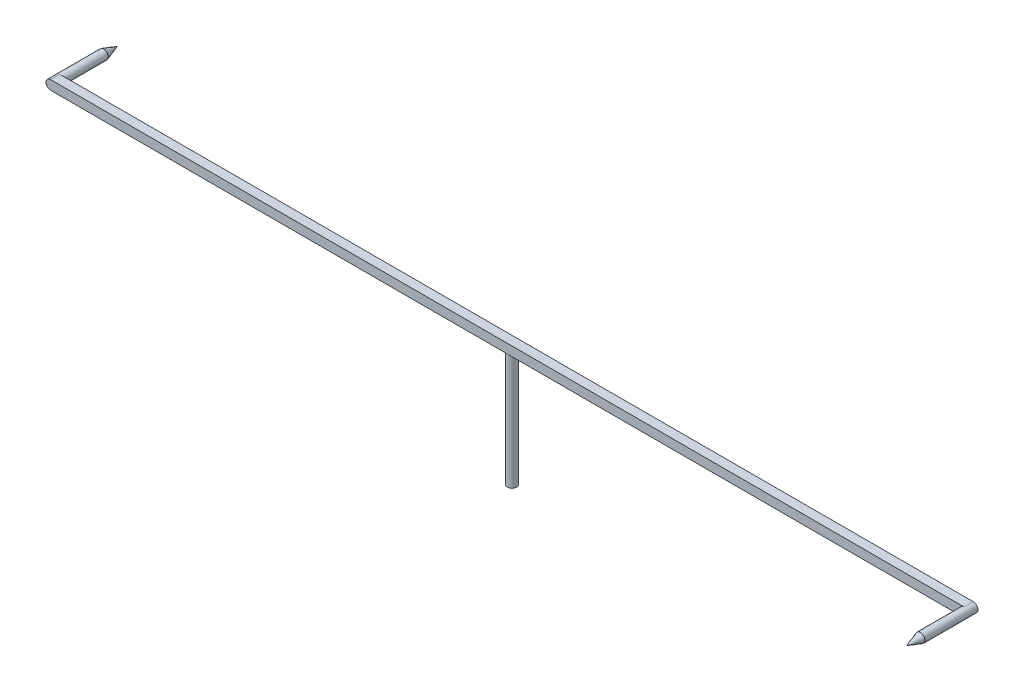
from build123d import *

# Parameters (mm, degrees)
SKETCH_1_R      = 0.4
EXTRUDE_1_DEPTH = 10
SKETCH_2_W      = 80
SKETCH_2_H      = 0.8
EXTRUDE_2_DEPTH = 0.8
FILLET_1_R      = 0.4
SKETCH_3_R      = 0.4
EXTRUDE_3_DEPTH = 3.8
SKETCH_4_R      = 0.4
EXTRUDE_4_DEPTH = 3.8


with BuildPart() as part:
    # 草图1 → 凸台-拉伸1 (new body)
    with BuildSketch(Plane(origin=(0, 0, 0), x_dir=(1, 0, 0), z_dir=(0, 1, 0))):
        with Locations(Location((0, 0, 0), (0, 0, 270))):
            Circle(SKETCH_1_R)
    extrude(amount=EXTRUDE_1_DEPTH)

    # 草图2 → 凸台-拉伸2 (add)
    with BuildSketch(Plane(origin=(0, 10, 0), x_dir=(1, 0, 0), z_dir=(0, 1, 0))):
        Rectangle(SKETCH_2_W, SKETCH_2_H)
    extrude(amount=EXTRUDE_2_DEPTH)

    # 圆角1
    fillet_1_edges = [part.edges().sort_by_distance(p)[0] for p in [
        (40, 10, 0),
        (40, 10.8, 0),
        (-40, 10, 0),
        (-40, 10.8, 0),
    ]]
    fillet(fillet_1_edges, radius=FILLET_1_R - 0.0001)  # a hair under: the kernel refuses the full size

    # 草图3 → 凸台-拉伸3 (add)
    with BuildSketch(Plane.XY.offset(0.4)):
        with Locations((39.6, 10.4)):
            Circle(SKETCH_3_R)
    extrude(amount=EXTRUDE_3_DEPTH)

    # 草图4 → 凸台-拉伸4 (add)
    with BuildSketch(Plane(origin=(0, 0, -0.4), x_dir=(-1, 0, 0), z_dir=(0, 0, -1))):
        with Locations((39.6, 10.4)):
            Circle(SKETCH_4_R)
    extrude(amount=EXTRUDE_4_DEPTH)

    # 草图5 → 旋转1 (revolve)
    with BuildSketch(Plane(origin=(0, 10.4, 0), x_dir=(1, 0, 0), z_dir=(0, 1, 0))):
        Polygon((39.6, -4.2), (39.6, -5.4), (40, -4.2), align=None)
    revolve(axis=Axis((39.6, 10.4, 4.2), (0, 0, 1)))

    # 草图6 → 旋转2 (revolve)
    with BuildSketch(Plane(origin=(0, 10.4, 0), x_dir=(1, 0, 0), z_dir=(0, 1, 0))):
        Polygon((-39.6, 4.2), (-39.6, 5.4), (-40, 4.2), align=None)
    revolve(axis=Axis((-39.6, 10.4, -4.2), (0, 0, -1)))


solid = part.part
